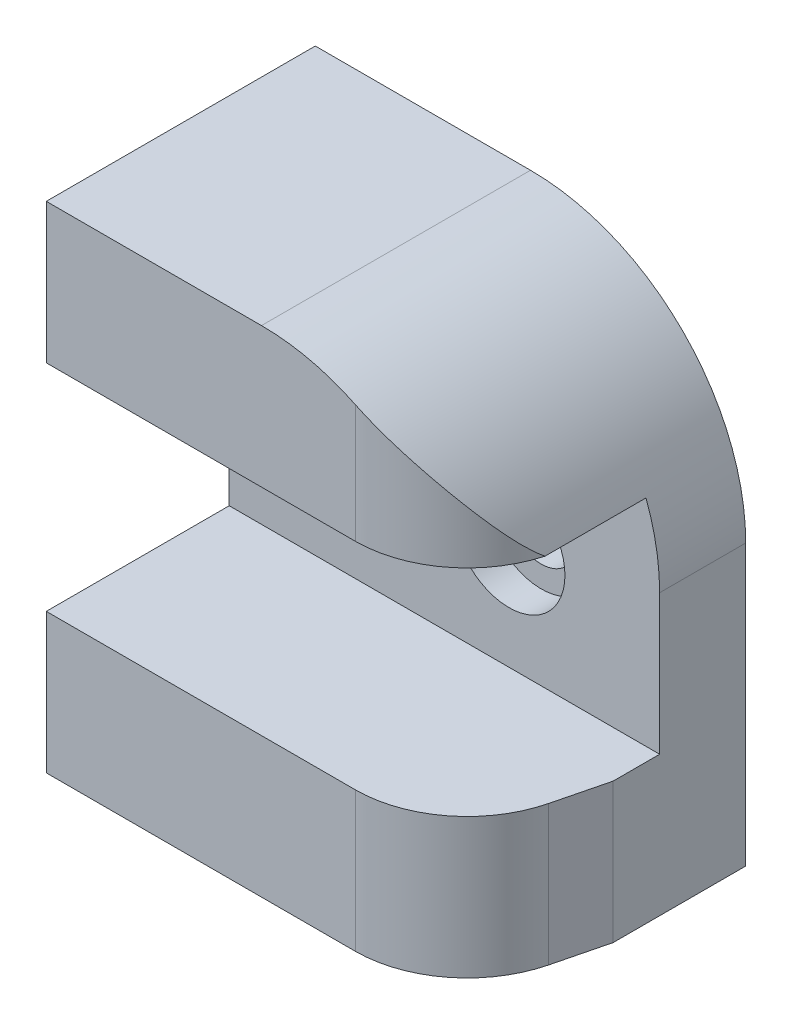
from build123d import *

# Parameters (mm, degrees)
EXTRUDE_1_DEPTH              = 12.5
CUT_EXTRUDE_1_DEPTH          = 26.5
SKETCH_3_W                   = 20
SKETCH_3_H                   = 10
CUT_EXTRUDE_2_DEPTH          = 8.5
HOLE_WIZARD_M3_1_D           = 3.2
HOLE_WIZARD_M3_1_CBORE_D     = 5.2
HOLE_WIZARD_M3_1_CBORE_DEPTH = 1.5


with BuildPart() as part:
    # 草图1 → 凸台-拉伸1 (new body)
    with BuildSketch(Plane.XY):
        with BuildLine():
            Line((130, 82), (110, 82))
            Line((110, 82), (110, 105))
            Line((110, 105), (120, 105))
            ThreePointArc((120, 105), (127.071067812, 102.071067812), (130, 95))
            Line((130, 95), (130, 82))
        make_face()
    extrude(amount=EXTRUDE_1_DEPTH)

    # 草图2 → 切除-拉伸1 (cut)
    with BuildSketch(Plane(origin=(0, 105, 0), x_dir=(1, 0, 0), z_dir=(0, 1, 0))):
        with BuildLine():
            Line((129.40254033, -8.557993857), (130, -6.161714003))
            Line((130, -6.161714003), (130, -12.5))
            Line((130, -12.5), (124.357002553, -12.5))
            ThreePointArc((124.357002553, -12.5), (127.558442225, -11.397655919), (129.40254033, -8.557993857))
        make_face()
    extrude(amount=-CUT_EXTRUDE_1_DEPTH, mode=Mode.SUBTRACT)

    # 草图3 → 切除-拉伸2 (cut)
    with BuildSketch(Plane.XY.offset(12.5)):
        with Locations((120, 93.5)):
            Rectangle(SKETCH_3_W, SKETCH_3_H)
    extrude(amount=-CUT_EXTRUDE_2_DEPTH, mode=Mode.SUBTRACT)

    # M3 六角头螺栓的柱形沉头孔1 (through all)
    with Locations(Plane.XY.offset(4)):
        with Locations((115, 93.5), (123, 93.5)):
            CounterBoreHole(HOLE_WIZARD_M3_1_D / 2, HOLE_WIZARD_M3_1_CBORE_D / 2, HOLE_WIZARD_M3_1_CBORE_DEPTH)


solid = part.part
